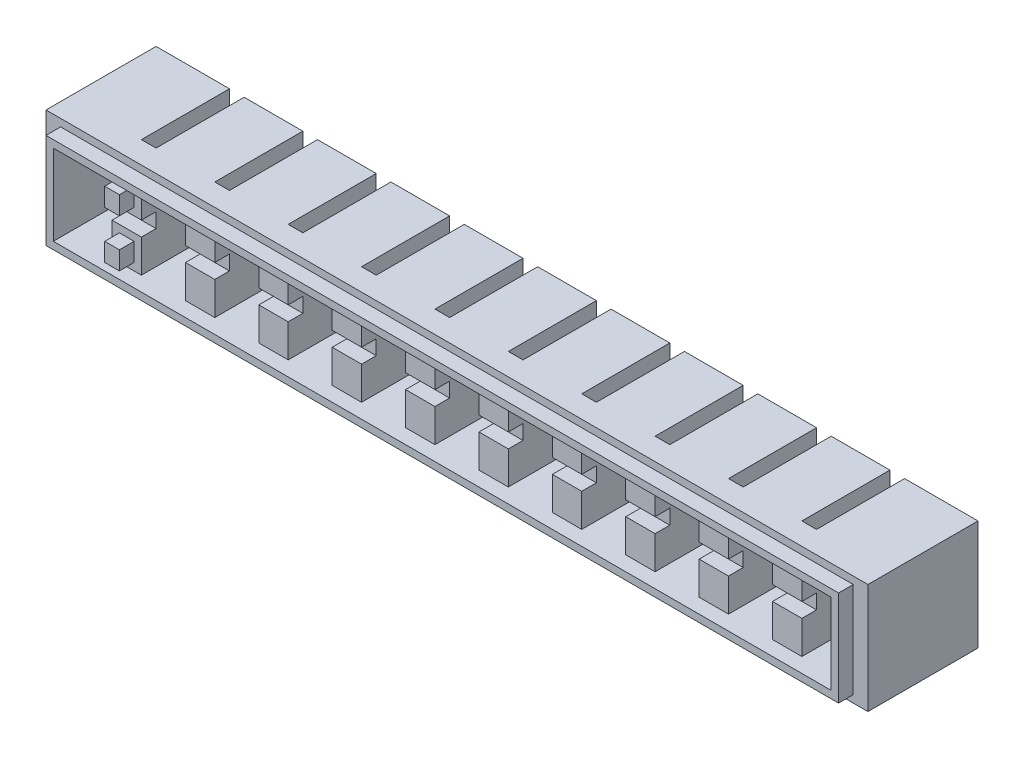
from build123d import *

# Parameters (mm, degrees)
EXTRUDE_1_OUTLINE_W    = 15
EXTRUDE_1_OUTLINE_H    = 15
EXTRUDE_1_DEPTH        = 8
SKETCH_2_W             = 6
SKETCH_2_H             = 11
CUT_EXTRUDE_1_DEPTH    = 13
SKETCH_3_W             = 3
SKETCH_3_H             = 15
EXTRUDE_2_DEPTH        = 2
PATTERN_LINEAR_2_COUNT = 11
PATTERN_LINEAR_2_PITCH = 10
SKETCH_5_W             = 12
SKETCH_5_H             = 15
EXTRUDE_3_DEPTH        = 2
SKETCH_6_W             = 15
SKETCH_6_H             = 15
EXTRUDE_4_DEPTH        = 2
SKETCH_7_W             = 94
SKETCH_7_H             = 2
CUT_EXTRUDE_2_DEPTH    = 2
SKETCH_9_W             = 108
SKETCH_9_H             = 13
SKETCH_9_W_2           = 106
SKETCH_9_H_2           = 11
EXTRUDE_5_DEPTH        = 2
SKETCH_10_W            = 2
SKETCH_10_H            = 2.5
EXTRUDE_6_DEPTH        = 2


# Read off the part's stored shape, not the designer's step: 凸台-拉伸1
with BuildPart() as part:
    # 凸台-拉伸1 outline → 凸台-拉伸1 (new body)
    with BuildSketch(Plane.YZ):
        with Locations((7.5, -7.5)):
            Rectangle(EXTRUDE_1_OUTLINE_W, EXTRUDE_1_OUTLINE_H)
    extrude(amount=EXTRUDE_1_DEPTH)

    # 草图2 → 切除-拉伸1 (cut)
    with BuildSketch(Plane.XY):
        with Locations((4, 7.5)):
            Rectangle(SKETCH_2_W, SKETCH_2_H)
    extrude(amount=-CUT_EXTRUDE_1_DEPTH, mode=Mode.SUBTRACT)

    # 草图3 → 凸台-拉伸2 (add)
    with BuildSketch(Plane(origin=(8, 0, 0), x_dir=(0, 0, -1), z_dir=(1, 0, 0))):
        with Locations((1.5, 7.5)):
            Rectangle(SKETCH_3_W, SKETCH_3_H)
    extrude(amount=EXTRUDE_2_DEPTH)


with BuildPart() as pattern_linear_2_1:
    # 阵列(线性)2: pattern copy
    add(part.part.moved(Location(Vector(1, 0, 0) * (1 * PATTERN_LINEAR_2_PITCH))))


with BuildPart() as pattern_linear_2_2:
    # 阵列(线性)2: pattern copy
    add(part.part.moved(Location(Vector(1, 0, 0) * (2 * PATTERN_LINEAR_2_PITCH))))


with BuildPart() as pattern_linear_2_3:
    # 阵列(线性)2: pattern copy
    add(part.part.moved(Location(Vector(1, 0, 0) * (3 * PATTERN_LINEAR_2_PITCH))))


with BuildPart() as pattern_linear_2_4:
    # 阵列(线性)2: pattern copy
    add(part.part.moved(Location(Vector(1, 0, 0) * (4 * PATTERN_LINEAR_2_PITCH))))


with BuildPart() as pattern_linear_2_5:
    # 阵列(线性)2: pattern copy
    add(part.part.moved(Location(Vector(1, 0, 0) * (5 * PATTERN_LINEAR_2_PITCH))))


with BuildPart() as pattern_linear_2_6:
    # 阵列(线性)2: pattern copy
    add(part.part.moved(Location(Vector(1, 0, 0) * (6 * PATTERN_LINEAR_2_PITCH))))


with BuildPart() as pattern_linear_2_7:
    # 阵列(线性)2: pattern copy
    add(part.part.moved(Location(Vector(1, 0, 0) * (7 * PATTERN_LINEAR_2_PITCH))))


with BuildPart() as pattern_linear_2_8:
    # 阵列(线性)2: pattern copy
    add(part.part.moved(Location(Vector(1, 0, 0) * (8 * PATTERN_LINEAR_2_PITCH))))


with BuildPart() as pattern_linear_2_9:
    # 阵列(线性)2: pattern copy
    add(part.part.moved(Location(Vector(1, 0, 0) * (9 * PATTERN_LINEAR_2_PITCH))))


with BuildPart() as pattern_linear_2_10:
    # 阵列(线性)2: pattern copy
    add(part.part.moved(Location(Vector(1, 0, 0) * (10 * PATTERN_LINEAR_2_PITCH))))


with BuildPart() as part_1:
    add(part.part)

    # Combine 2: union 阵列(线性)2_1, 阵列(线性)2_2, 阵列(线性)2_3, 阵列(线性)2_4, 阵列(线性)2_5, 阵列(线性)2_6, 阵列(线性)2_7, 阵列(线性)2_8, 阵列(线性)2_9, 阵列(线性)2_10
    add(pattern_linear_2_1.part)
    add(pattern_linear_2_2.part)
    add(pattern_linear_2_3.part)
    add(pattern_linear_2_4.part)
    add(pattern_linear_2_5.part)
    add(pattern_linear_2_6.part)
    add(pattern_linear_2_7.part)
    add(pattern_linear_2_8.part)
    add(pattern_linear_2_9.part)
    add(pattern_linear_2_10.part)

    # 草图5 → 凸台-拉伸3 (add)
    with BuildSketch(Plane(origin=(108, 0, 0), x_dir=(0, 0, -1), z_dir=(1, 0, 0))):
        with Locations((9, 7.5)):
            Rectangle(SKETCH_5_W, SKETCH_5_H)
    extrude(amount=EXTRUDE_3_DEPTH)

    # 草图6 → 凸台-拉伸4 (add)
    with BuildSketch(Plane.ZY):
        with Locations((-7.5, 7.5)):
            Rectangle(SKETCH_6_W, SKETCH_6_H)
    extrude(amount=EXTRUDE_4_DEPTH)

    # 草图7 → 切除-拉伸2 (cut)
    with BuildSketch(Plane.XY):
        with Locations((54, 7.5)):
            Rectangle(SKETCH_7_W, SKETCH_7_H)
    extrude(amount=-CUT_EXTRUDE_2_DEPTH, mode=Mode.SUBTRACT)

    # 草图9 → 凸台-拉伸5 (add)
    with BuildSketch(Plane.XY):
        with Locations((54, 7.5)):
            Rectangle(SKETCH_9_W, SKETCH_9_H)
        with Locations((54, 7.5)):
            Rectangle(SKETCH_9_W_2, SKETCH_9_H_2, mode=Mode.SUBTRACT)
    extrude(amount=EXTRUDE_5_DEPTH)

    # 草图10 → 凸台-拉伸6 (add)
    with BuildSketch(Plane.XY):
        with Locations((9, 4.25)):
            Rectangle(SKETCH_10_W, SKETCH_10_H)
        with Locations((9, 10.75)):
            Rectangle(SKETCH_10_W, SKETCH_10_H)
    extrude(amount=EXTRUDE_6_DEPTH)


solid = part_1.part
